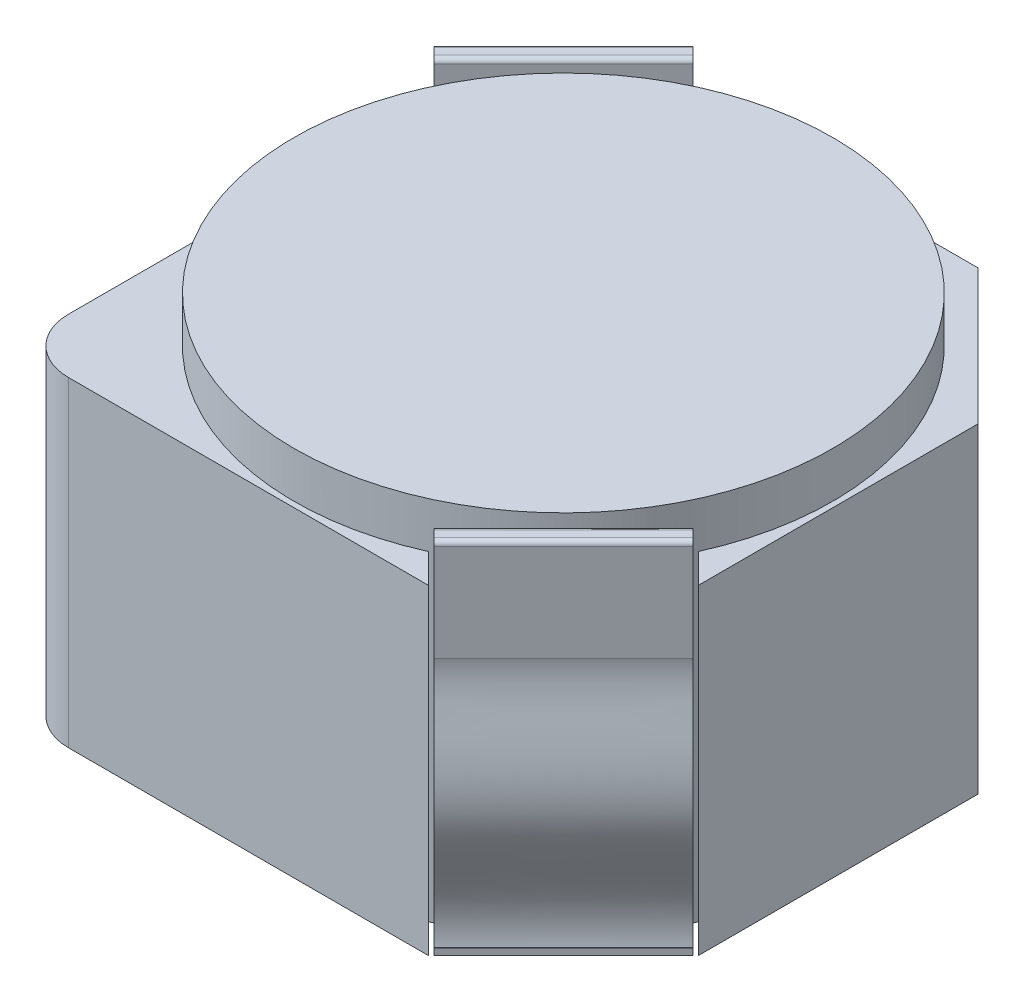
from build123d import *

# Parameters (mm, degrees)
SKETCH1_W            = 3
SKETCH1_H            = 3
BOSS_EXTRUDE1_DEPTH  = 1.75
CUT_EXTRUDE1_DEPTH   = 5.589389938
FILLET2_R            = 0.3
SKETCH4_R            = 1.47
BOSS_EXTRUDE2_DEPTH  = 0.25
CUT_EXTRUDE2_START   = -1.75
CUT_EXTRUDE2_DEPTH   = 1.75
EXTRUDE_THIN2_START  = -0.5
EXTRUDE_THIN2_DEPTH  = 1
SKETCH8_W            = 0.275860762
SKETCH8_H            = 0.1
EXTRUDE_THIN5_DEPTH  = 0.05
FILLET3_R            = 0.025
FILLET3_OF_MIRROR1_R = 0.025
BOSS_EXTRUDE3_START  = -0.015
BOSS_EXTRUDE3_DEPTH  = 0.035
SKETCH11_R           = 1.05
CUT_EXTRUDE3_DEPTH   = 0.02


# Read off the part's stored shape, not the designer's step: Extrude-Thin2
with BuildPart() as part:
    # Sketch1 → Boss-Extrude1 (new body)
    with BuildSketch(Plane(origin=(0, 0, 0), x_dir=(1, 0, 0), z_dir=(0, 1, 0))):
        with Locations((1.5, 1.5)):
            Rectangle(SKETCH1_W, SKETCH1_H)
    extrude(amount=BOSS_EXTRUDE1_DEPTH)

    # Sketch3 → Cut-Extrude1 (cut, through all)
    with BuildSketch(Plane(origin=(0, 1.75, 0), x_dir=(1, 0, 0), z_dir=(0, 1, 0))):
        Polygon((2.2627417, 0), (3, 0), (3, 0.7372583), (2.63137085, 0.36862915), align=None)
        Polygon((0, 3), (0, 2.2627417), (0.36862915, 2.63137085), (0.7372583, 3), align=None)
        Polygon((2.63137085, 2.63137085), (2.2627417, 3), (3, 3), (3, 2.2627417), align=None)
    extrude(amount=-CUT_EXTRUDE1_DEPTH, mode=Mode.SUBTRACT)

    # Fillet2
    fillet2_edges = [part.edges().sort_by_distance(p)[0] for p in [
        (0, 0.875, 0),
    ]]
    fillet(fillet2_edges, radius=FILLET2_R)

    # Sketch4 → Boss-Extrude2 (add)
    with BuildSketch(Plane(origin=(0, 1.75, 0), x_dir=(1, 0, 0), z_dir=(0, 1, 0))):
        with Locations(Location((1.5, 1.5, 0), (0, 0, 90))):
            Circle(SKETCH4_R)
    extrude(amount=BOSS_EXTRUDE2_DEPTH)

    # Sketch5 → Cut-Extrude2 (cut)
    with BuildSketch(Plane(origin=(0, 1.75, 0), x_dir=(1, 0, 0), z_dir=(0, 1, 0)).offset(CUT_EXTRUDE2_START)):
        with BuildLine():
            Line((2.2627417, 0), (2.103256928, 0.159484771))
            ThreePointArc((2.103256928, 0.159484771), (2.539446968, 0.460553032), (2.840515229, 0.896743072))
            Line((2.840515229, 0.896743072), (3, 0.7372583))
            Line((3, 0.7372583), (2.2627417, 0))
        make_face()
        with BuildLine():
            Line((0, 2.2627417), (0.7372583, 3))
            Line((0.7372583, 3), (0.896743072, 2.840515229))
            ThreePointArc((0.896743072, 2.840515229), (0.460553032, 2.539446968), (0.159484771, 2.103256928))
            Line((0.159484771, 2.103256928), (0, 2.2627417))
        make_face()
    extrude(amount=CUT_EXTRUDE2_DEPTH, mode=Mode.SUBTRACT)

    # Extrude-Thin2 outline → Extrude-Thin2 (add)
    with BuildSketch(Plane(origin=(1.5, 0, -1.5), x_dir=(0.7071067811865562, 0, 0.7071067811865389), z_dir=(-0.7071067811865389, 0, 0.7071067811865562)).offset(EXTRUDE_THIN2_START)):
        with BuildLine():
            Line((1.561450527, 2.002149754), (1.561450527, 1.451909895))
            add(Edge.make_bspline(
                [(1.561450527, 1.451909895), (1.554129937, 1.375541591), (1.563884147, 1.305446664), (1.588296687, 1.177370221), (1.602428817, 1.117821497), (1.625651298, 0.999523371), (1.634934751, 0.941975625), (1.642707118, 0.832429946), (1.641292118, 0.781821785), (1.613986886, 0.631102389), (1.563318355, 0.52128951), (1.475495605, 0.275380517), (1.439010548, 0.134450447), (1.472207974, -0.02089784)],
                knots=[0, 0, 0, 0, 0.125, 0.125, 0.25, 0.25, 0.375, 0.375, 0.5, 0.5, 0.75, 0.75, 1, 1, 1, 1], degree=3))
            Line((1.472207974, -0.02089784), (1.57, 0))
            add(Edge.make_bspline(
                [(1.661450527, 1.446877551), (1.653220606, 1.369619132), (1.670197461, 1.275795935), (1.720944437, 1.040930532), (1.805154039, 0.618915062), (1.512916634, 0.267123211), (1.57, 0)],
                knots=[0, 0, 0, 0, 0.155054635, 0.196256757, 0.482900157, 1, 1, 1, 1], degree=3))
            Line((1.661450527, 1.446877551), (1.661450527, 2.002149754))
            Line((1.661450527, 2.002149754), (1.561450527, 2.002149754))
        make_face()
    extrude_thin2 = extrude(amount=EXTRUDE_THIN2_DEPTH)

    # Sketch8 → Extrude-Thin5 (add, symmetric)
    with BuildSketch(Plane(origin=(1.5, 0, -1.5), x_dir=(0.7071067811865562, 0, 0.7071067811865389), z_dir=(-0.7071067811865389, 0, 0.7071067811865562))):
        with Locations((1.518388241, 1.787476875)):
            Rectangle(SKETCH8_W, SKETCH8_H)
    extrude_thin5 = extrude(amount=EXTRUDE_THIN5_DEPTH, both=True)

    # Fillet3
    fillet3_edges = [part.edges().sort_by_distance(p)[0] for p in [
        (2.674822934, 2.002149754, -0.325177066),
        (2.604112256, 2.002149754, -0.395887744),
    ]]
    fillet(fillet3_edges, radius=FILLET3_R)

    # Mirror1: Extrude-Thin2, Extrude-Thin5 across plane
    add(extrude_thin2.mirror(Plane(origin=(0, 0, 0), x_dir=(-0.7071067811865466, 0, 0.7071067811865486), z_dir=(0.7071067811865487, 0, 0.7071067811865465))))
    add(extrude_thin5.mirror(Plane(origin=(0, 0, 0), x_dir=(-0.7071067811865466, 0, 0.7071067811865486), z_dir=(0.7071067811865487, 0, 0.7071067811865465))))

    # Fillet3 of Mirror1
    fillet3_of_mirror1_edges = [part.edges().sort_by_distance(p)[0] for p in [
        (0.325177066, 2.002149754, -2.674822934),
        (0.395887744, 2.002149754, -2.604112256),
    ]]
    fillet(fillet3_of_mirror1_edges, radius=FILLET3_OF_MIRROR1_R)

    # Sketch10 → Boss-Extrude3 (add)
    with BuildSketch(Plane.XZ.offset(BOSS_EXTRUDE3_START)):
        Polygon((0.036288963, -2.256604256), (2.256604256, -0.036288963), (2.963711037, -0.743395744), (0.743395744, -2.963711037), align=None)
    extrude(amount=BOSS_EXTRUDE3_DEPTH)

    # Sketch11 → Cut-Extrude3 (cut)
    with BuildSketch(Plane.XZ.offset(0.02)):
        with Locations((1.5, -1.5)):
            Circle(SKETCH11_R)
    extrude(amount=-CUT_EXTRUDE3_DEPTH, mode=Mode.SUBTRACT)


solid = part.part
